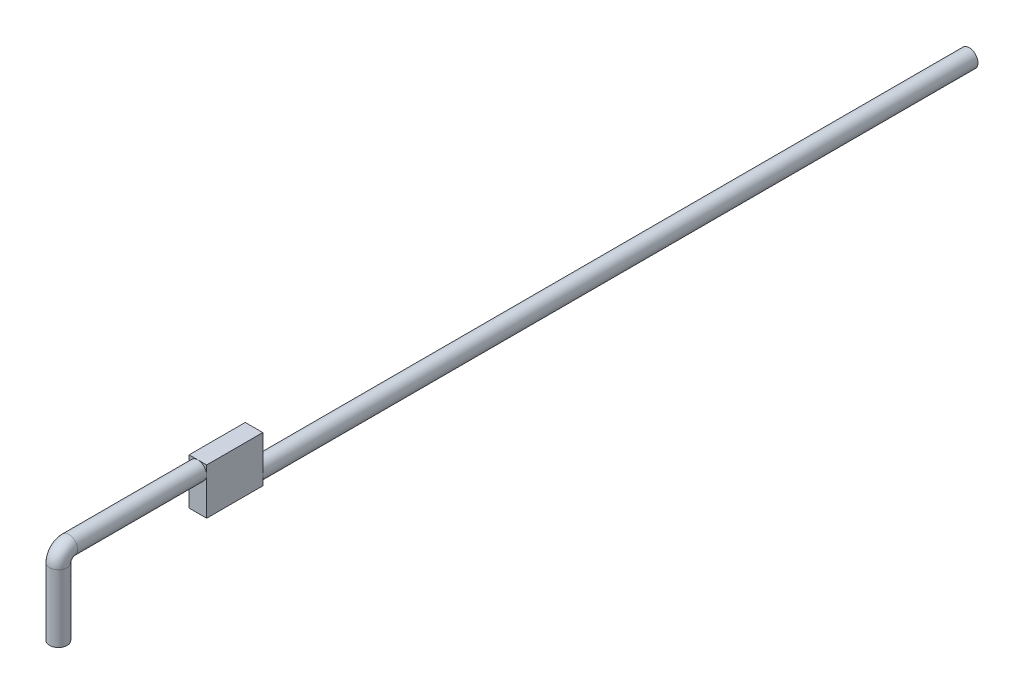
from build123d import *

# Parameters (mm, degrees)
SKETCH1_R                = 1.984375
BOSS_EXTRUDE1_DEPTH      = 168.275
BOSS_EXTRUDE2_DEPTH      = 6.35
BOSS_EXTRUDE2_DEPTH_BACK = 6.35
SKETCH2_W                = 3.96875
SKETCH2_H                = 10.455629562
SKETCH3_R                = 1.984375
BOSS_EXTRUDE3_DEPTH      = 29.21
SKETCH4_R                = 1.984375
REVOLVE5_ANGLE           = 90
SKETCH6_R                = 1.984375
BOSS_EXTRUDE4_DEPTH      = 15.24


with BuildPart() as part:
    # Sketch1 → Boss-Extrude1 (new body)
    with BuildSketch(Plane.XY):
        Circle(SKETCH1_R)
    extrude(amount=BOSS_EXTRUDE1_DEPTH)

    # Sketch2 → Boss-Extrude2 (add, two sides: drawn at the far end of the back side and taken through both)
    with BuildSketch(Plane.XY.offset(168.275).offset(-BOSS_EXTRUDE2_DEPTH_BACK)):
        with Locations((0, 3.243439781)):
            Rectangle(SKETCH2_W, SKETCH2_H)
    extrude(amount=BOSS_EXTRUDE2_DEPTH + BOSS_EXTRUDE2_DEPTH_BACK)

    # Sketch3 → Boss-Extrude3 (add)
    with BuildSketch(Plane.XY.offset(174.625)):
        with Locations((0, 6.486879562)):
            Circle(SKETCH3_R)
    extrude(amount=BOSS_EXTRUDE3_DEPTH)

    # Sketch4 → Revolve5 (revolve)
    with BuildSketch(Plane.XY.offset(203.835)):
        with Locations((0, 6.486879562)):
            Circle(SKETCH4_R)
    revolve(axis=Axis((-5.972283048, 4.112992181, 203.835), (1, 0, 0)), revolution_arc=REVOLVE5_ANGLE)

    # Sketch6 → Boss-Extrude4 (add)
    with BuildSketch(Plane.XZ.offset(-4.112992181)):
        with Locations((0, 206.208887382)):
            Circle(SKETCH6_R)
    extrude(amount=BOSS_EXTRUDE4_DEPTH)


solid = part.part
